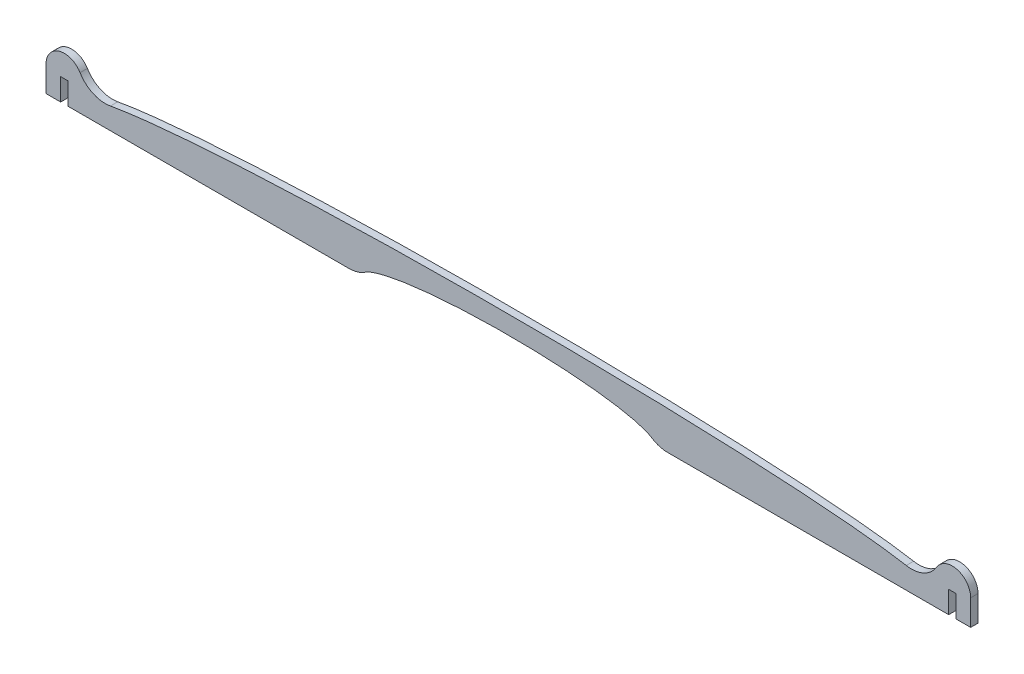
from build123d import *

# Parameters (mm, degrees)
BOSS_EXTRUDE1_DEPTH = 3.175
FILLET1_START       = -1
FILLET1_DEPTH       = 5
FILLET1_2_DEPTH     = 3.175


with BuildPart() as part:
    # Sketch1 → Boss-Extrude1 (new body)
    with BuildSketch(Plane.XY):
        with BuildLine():
            Line((-200.025, 0), (-193.675, 0))
            Line((-193.675, 0), (-193.675, 9.525))
            Line((-193.675, 9.525), (-190.5, 9.525))
            Line((-190.5, 9.525), (-190.5, 0))
            Line((-190.5, 0), (-63.5, 0))
            add(Edge.make_bspline(
                [(63.5, 0), (63.5, 9.525), (0, 9.525), (-63.5, 9.525), (-63.5, 0)],
                knots=[0, 0, 0, 1.570796327, 1.570796327, 3.141592654, 3.141592654, 3.141592654], degree=2, weights=[1, 0.707106781, 1, 0.707106781, 1]))
            Line((63.5, 0), (190.5, 0))
            Line((190.5, 0), (190.5, 9.525))
            Line((190.5, 9.525), (193.675, 9.525))
            Line((193.675, 9.525), (193.675, 0))
            Line((193.675, 0), (200.025, 0))
            Line((200.025, 0), (200.025, 11.1125))
            ThreePointArc((200.025, 11.1125), (192.0875, 19.05), (184.15, 11.1125))
            Line((184.15, 11.1125), (184.15, 4.7625))
            add(Edge.make_bspline(
                [(184.15, 4.7625), (184.15, 17.4625), (0, 17.4625), (-184.15, 17.4625), (-184.15, 4.7625)],
                knots=[3.141592654, 3.141592654, 3.141592654, 4.71238898, 4.71238898, 6.283185307, 6.283185307, 6.283185307], degree=2, weights=[1, 0.707106781, 1, 0.707106781, 1]))
            Line((-184.15, 4.7625), (-184.15, 11.1125))
            ThreePointArc((-184.15, 11.1125), (-192.0875, 19.05), (-200.025, 11.1125))
            Line((-200.025, 11.1125), (-200.025, 0))
        make_face()
    extrude(amount=BOSS_EXTRUDE1_DEPTH)

    # Fillet1: read off the stored shape, not the designer's step
    # Fillet1 outline → Fillet1 (cut)
    with BuildSketch(Plane.XY.offset(FILLET1_START)):
        with BuildLine():
            Line((63.5, 0), (68.93249598, 0))
            ThreePointArc((68.93249598, 0), (65.274773746, 0.538130569), (61.927025079, 2.106918416))
            add(Edge.make_bspline(
                [(61.927025079, 2.106918416), (63.5, 1.066670594), (63.5, 0)],
                knots=[2.903849416, 2.903849416, 2.903849416, 3.141592654, 3.141592654, 3.141592654], degree=2, weights=[0.924758893, 0.955670012, 1]))
        make_face()
        with BuildLine():
            add(Edge.make_bspline(
                [(-63.5, 0), (-63.5, 1.066670594), (-61.927025079, 2.106918416)],
                knots=[0, 0, 0, 0.237743237, 0.237743237, 0.237743237], degree=2, weights=[1, 0.955670012, 0.924758893]))
            ThreePointArc((-61.927025079, 2.106918416), (-65.274773746, 0.538130569), (-68.93249598, 0))
            Line((-68.93249598, 0), (-63.5, 0))
        make_face()
    extrude(amount=FILLET1_DEPTH, mode=Mode.SUBTRACT)

    # Fillet1 2 outline → Fillet1 2 (add)
    with BuildSketch(Plane.XY):
        with BuildLine():
            ThreePointArc((184.15, 11.1125), (184.440305246, 13.23954458), (185.2899858, 15.211000574))
            ThreePointArc((185.2899858, 15.211000574), (179.642574002, 10.194854138), (172.145584932, 9.272823784))
            add(Edge.make_bspline(
                [(184.15, 4.7625), (184.15, 7.093643466), (172.145584932, 9.272823784)],
                knots=[3.141592654, 3.141592654, 3.141592654, 3.520537016, 3.520537016, 3.520537016], degree=2, weights=[1, 0.929341422, 0.892774686]))
            Line((184.15, 4.7625), (184.15, 11.1125))
        make_face()
        with BuildLine():
            add(Edge.make_bspline(
                [(-172.145584932, 9.272823784), (-184.15, 7.093643466), (-184.15, 4.7625)],
                knots=[5.904240944, 5.904240944, 5.904240944, 6.283185307, 6.283185307, 6.283185307], degree=2, weights=[0.892774686, 0.929341422, 1]))
            ThreePointArc((-172.145584932, 9.272823784), (-179.642574002, 10.194854138), (-185.289985801, 15.211000574))
            ThreePointArc((-185.289985801, 15.211000574), (-184.440305246, 13.23954458), (-184.15, 11.1125))
            Line((-184.15, 11.1125), (-184.15, 4.7625))
        make_face()
    extrude(amount=FILLET1_2_DEPTH)


solid = part.part
